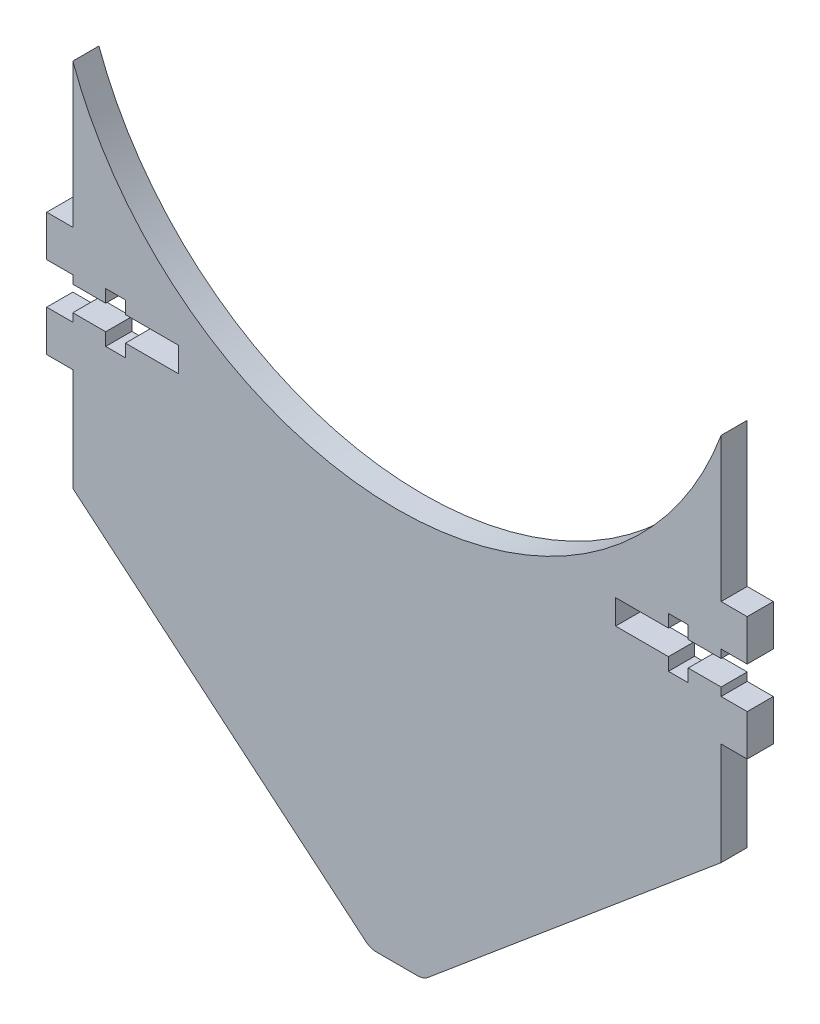
from build123d import *

# Parameters (mm, degrees)
BOSS_EXTRUDE1_DEPTH = 3.175
SKETCH2_W           = 3.175
SKETCH2_H           = 5
BOSS_EXTRUDE2_DEPTH = 3.175
CUT_EXTRUDE1_DEPTH  = 67.034660983


with BuildPart() as part:
    # Sketch1 → Boss-Extrude1 (new body)
    with BuildSketch(Plane.XY):
        with BuildLine():
            Line((39.415, -20), (39.415, 25))
            ThreePointArc((39.415, 25), (0, -2.492837114), (-39.415, 25))
            Line((-39.415, 25), (-39.415, -20))
            Line((-39.415, -20), (-3.785575219, -49.896637192))
            ThreePointArc((-3.785575219, -49.896637192), (-3.184040287, -50.243933548), (-2.5, -50.364548306))
            Line((-2.5, -50.364548306), (2.5, -50.364548306))
            ThreePointArc((2.5, -50.364548306), (3.184040287, -50.243933548), (3.785575219, -49.896637192))
            Line((3.785575219, -49.896637192), (39.415, -20))
        make_face()
    extrude(amount=BOSS_EXTRUDE1_DEPTH)

    # Sketch2 → Boss-Extrude2 (add)
    with BuildSketch(Plane.XY.offset(3.175)):
        with Locations((41.0025, -5)):
            Rectangle(SKETCH2_W, SKETCH2_H)
        with Locations((41.0025, 5)):
            Rectangle(SKETCH2_W, SKETCH2_H)
        with Locations((-41.0025, 5)):
            Rectangle(SKETCH2_W, SKETCH2_H)
        with Locations((-41.0025, -5)):
            Rectangle(SKETCH2_W, SKETCH2_H)
    extrude(amount=-BOSS_EXTRUDE2_DEPTH)

    # Sketch3 → Cut-Extrude1 (cut, through all)
    with BuildSketch(Plane.XY.offset(3.175)):
        Polygon((39.415, 1.5), (35.415, 1.5), (35.415, 3.05), (33.015, 3.05), (33.015, 1.5), (26.59, 1.5), (26.59, -1.5), (33.015, -1.5), (33.015, -3.05), (35.415, -3.05), (35.415, -1.5), (39.415, -1.5), align=None)
        Polygon((-39.415, -1.5), (-35.415, -1.5), (-35.415, -3.05), (-33.015, -3.05), (-33.015, -1.5), (-26.59, -1.5), (-26.59, 1.5), (-33.015, 1.5), (-33.015, 3.05), (-35.415, 3.05), (-35.415, 1.5), (-39.415, 1.5), align=None)
    extrude(amount=-CUT_EXTRUDE1_DEPTH, mode=Mode.SUBTRACT)


solid = part.part
